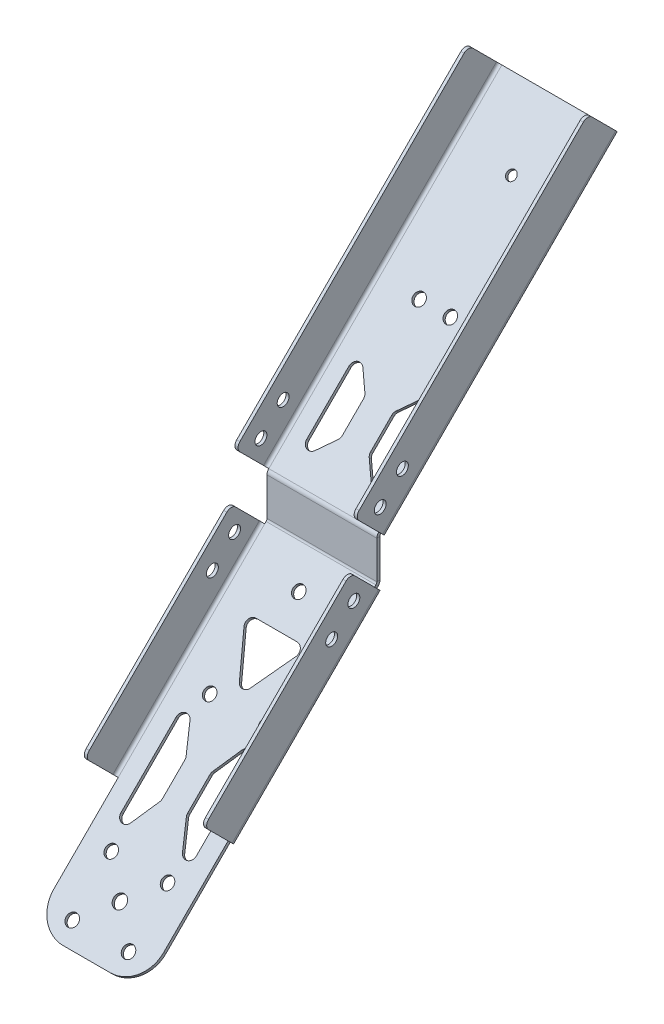
from build123d import *

# Parameters (mm, degrees)
BASE_FLANGE1_DEPTH     = 1
SKETCHED_START         = -32.5
SKETCHED_BEND5_DEPTH   = 65
SKETCHED_BEND5_2_DEPTH = 15
SKETCHED_START_2       = 17.5
SKETCHED_BEND5_3_DEPTH = 15
SKETCHED_BEND5_4_DEPTH = 65
SKETCHED_START_3       = -17.5
SKETCHED_BEND5_5_DEPTH = 35
SKETCHED_BEND6_DEPTH   = 65
SKETCHED_BEND6_2_DEPTH = 15
SKETCHED_BEND6_3_DEPTH = 15
SKETCHED_BEND6_4_DEPTH = 65
SKETCHED_BEND6_5_DEPTH = 35
SKETCHED_START_4       = -71.356310605
SKETCHED_BEND7_DEPTH   = 66
SKETCHED_BEND7_2_DEPTH = 66
SKETCHED_START_5       = 5.890889039
SKETCHED_BEND8_DEPTH   = 105
SKETCHED_BEND8_2_DEPTH = 105
F_6_CLEARANCE_HOLE2_D  = 3.7973
CUT_EXTRUDE1_REACH     = 121.977
SKETCH16_R             = 1.525
CUT_EXTRUDE2_REACH     = 127.221
SKETCH31_R             = 2.025
F_6_CLEARANCE_HOLE4_D  = 3.7973
F_6_CLEARANCE_HOLE5_D  = 3.7973
FILLET1_R              = 10
FILLET2_R              = 2


# Read off the part's stored shape, not the designer's step: Sketched Bend5, Sketched Bend6, Sketched Bend7, Sketched Bend8
# Sheet-metal steps are written as plain solids
with BuildPart() as part:
    # Sketch1 → Base-Flange1 (new body)
    with BuildSketch(Plane.XY):
        Polygon((-32.5, -73.5), (-17.5, -73.5), (-17.5, -112.5), (17.5, -112.5), (17.5, -73.5), (32.5, -73.5), (32.5, -7.5), (17.5, -7.5), (17.5, 7.5), (32.5, 7.5), (32.5, 112.5), (17.5, 112.5), (-17.5, 112.5), (-32.5, 112.5), (-32.5, 7.5), (-17.5, 7.5), (-17.5, -7.5), (-32.5, -7.5), align=None)
    extrude(amount=-BASE_FLANGE1_DEPTH)

    # Sketched Bend5 outline → Sketched Bend5 (cut)
    with BuildSketch(Plane.YZ.offset(SKETCHED_START)):
        with BuildLine():
            Line((7.714213562, -0.585786438), (8.128427124, -1))
            Line((8.128427124, -1), (112.5, -1))
            Line((112.5, -1), (112.5, 0))
            Line((112.5, 0), (6.3, 0))
            ThreePointArc((6.3, 0), (7.065366865, -0.152240935), (7.714213562, -0.585786438))
        make_face()
    extrude(amount=SKETCHED_BEND5_DEPTH, mode=Mode.SUBTRACT)

    # Sketched Bend5 2 outline → Sketched Bend5 2 (cut)
    with BuildSketch(Plane.YZ.offset(SKETCHED_START)):
        with BuildLine():
            Line((7.729701149, -0.601274024), (7.714213562, -0.585786438))
            ThreePointArc((7.714213562, -0.585786438), (7.610403483, -0.48909209), (7.5, -0.4))
            Line((7.5, -0.4), (7.5, -0.830975173))
            Line((7.5, -0.830975173), (7.729701149, -0.601274024))
        make_face()
    extrude(amount=SKETCHED_BEND5_2_DEPTH, mode=Mode.SUBTRACT)

    # Sketched Bend5 3 outline → Sketched Bend5 3 (cut)
    with BuildSketch(Plane.YZ.offset(SKETCHED_START_2)):
        with BuildLine():
            Line((7.729701149, -0.601274024), (7.714213562, -0.585786438))
            ThreePointArc((7.714213562, -0.585786438), (7.610403483, -0.48909209), (7.5, -0.4))
            Line((7.5, -0.4), (7.5, -0.830975173))
            Line((7.5, -0.830975173), (7.729701149, -0.601274024))
        make_face()
    extrude(amount=SKETCHED_BEND5_3_DEPTH, mode=Mode.SUBTRACT)

    # Sketched Bend5 4 outline → Sketched Bend5 4 (add)
    with BuildSketch(Plane.YZ.offset(SKETCHED_START)):
        Polygon((81.975913173, -74.847486049), (8.128427124, -1), (7.5, -1), (7.5, -0.830975173), (7.022594368, -1.308380805), (81.268806392, -75.55459283), align=None)
    extrude(amount=SKETCHED_BEND5_4_DEPTH)

    # Sketched Bend5 5 outline → Sketched Bend5 5 (add)
    with BuildSketch(Plane.YZ.offset(SKETCHED_START_3)):
        with BuildLine():
            Line((7.022594368, -1.308380805), (7.330975173, -1))
            Line((7.330975173, -1), (6.3, -1))
            ThreePointArc((6.3, -1), (6.682683432, -1.076120467), (7.007106781, -1.292893219))
            Line((7.007106781, -1.292893219), (7.022594368, -1.308380805))
        make_face()
    extrude(amount=SKETCHED_BEND5_5_DEPTH)

    # Sketched Bend6 outline → Sketched Bend6 (cut)
    with BuildSketch(Plane.YZ.offset(SKETCHED_START)):
        with BuildLine():
            ThreePointArc((-5.710951377, -1), (-6.476318242, -0.847759065), (-7.12516494, -0.414213562))
            Line((-7.12516494, -0.414213562), (-7.539378502, 0))
            Line((-7.539378502, 0), (-112.5, 0))
            Line((-112.5, 0), (-112.5, -1))
            Line((-112.5, -1), (-5.710951377, -1))
        make_face()
    extrude(amount=SKETCHED_BEND6_DEPTH, mode=Mode.SUBTRACT)

    # Sketched Bend6 2 outline → Sketched Bend6 2 (cut)
    with BuildSketch(Plane.YZ.offset(SKETCHED_START)):
        Polygon((-7.539378502, 0), (-7.5, -0.039378502), (-7.5, 0), align=None)
    extrude(amount=SKETCHED_BEND6_2_DEPTH, mode=Mode.SUBTRACT)

    # Sketched Bend6 3 outline → Sketched Bend6 3 (cut)
    with BuildSketch(Plane.YZ.offset(SKETCHED_START_2)):
        Polygon((-7.539378502, 0), (-7.5, -0.039378502), (-7.5, 0), align=None)
    extrude(amount=SKETCHED_BEND6_3_DEPTH, mode=Mode.SUBTRACT)



with BuildPart() as body_2:
    # Sketched Bend6 4 outline → Sketched Bend6 4 (new body)
    with BuildSketch(Plane.YZ.offset(SKETCHED_START)):
        Polygon((-54.22622036, 46.686841858), (-7.557172802, 0.0177943), (-6.850066021, 0.724901081), (-53.519113579, 47.393948639), align=None)
    extrude(amount=SKETCHED_BEND6_4_DEPTH)


with BuildPart() as part_1:
    add(part.part)

    add(body_2.part)  # Sketched Bend6 5 merges body 2
    # Sketched Bend6 5 outline → Sketched Bend6 5 (add)
    with BuildSketch(Plane.YZ.offset(SKETCHED_START_3)):
        with BuildLine():
            Line((-7.557172802, 0.0177943), (-7.539378502, 0))
            Line((-7.539378502, 0), (-5.710951377, 0))
            ThreePointArc((-5.710951377, 0), (-6.09363481, 0.076120467), (-6.418058159, 0.292893219))
            Line((-6.418058159, 0.292893219), (-6.850066021, 0.724901081))
            Line((-6.850066021, 0.724901081), (-7.557172802, 0.0177943))
        make_face()
        Polygon((-81.803384826, 74.264006324), (-54.22622036, 46.686841858), (-53.519113579, 47.393948639), (-81.096278045, 74.971113105), align=None)
    extrude(amount=SKETCHED_BEND6_5_DEPTH)

    # Sketched Bend7 outline → Sketched Bend7 (cut)
    with BuildSketch(Plane(origin=(0, 0, 0), x_dir=(1, 0, 0), z_dir=(0, 0.707106781186546, -0.707106781186549)).offset(SKETCHED_START_4)):
        with BuildLine():
            ThreePointArc((-19.232050807, 4.331145665), (-18.5, 5.063196472), (-17.5, 5.331145665))
            Line((-17.5, 5.331145665), (-32.5, 5.331145665))
            Line((-32.5, 5.331145665), (-32.5, 4.331145665))
            Line((-32.5, 4.331145665), (-19.232050807, 4.331145665))
        make_face()
        with BuildLine():
            Line((32.5, 5.331145665), (17.5, 5.331145665))
            ThreePointArc((17.5, 5.331145665), (18.5, 5.063196472), (19.232050807, 4.331145665))
            Line((19.232050807, 4.331145665), (32.5, 4.331145665))
            Line((32.5, 4.331145665), (32.5, 5.331145665))
        make_face()
    extrude(amount=SKETCHED_BEND7_DEPTH, mode=Mode.SUBTRACT)

    # Sketched Bend7 2 outline → Sketched Bend7 2 (add)
    with BuildSketch(Plane(origin=(0, 0, 0), x_dir=(1, 0, 0), z_dir=(0, 0.707106781186546, -0.707106781186549)).offset(SKETCHED_START_4)):
        with BuildLine():
            Line((-17.5, 4.331145665), (-19.232050807, 4.331145665))
            ThreePointArc((-19.232050807, 4.331145665), (-19.431851652, 3.848783755), (-19.5, 3.331145665))
            Line((-19.5, 3.331145665), (-19.5, -9.312659845))
            Line((-19.5, -9.312659845), (-18.5, -9.312659845))
            Line((-18.5, -9.312659845), (-18.5, 3.331145665))
            ThreePointArc((-18.5, 3.331145665), (-18.207106781, 4.038252446), (-17.5, 4.331145665))
        make_face()
        with BuildLine():
            ThreePointArc((19.5, 3.331145665), (19.431851652, 3.848783755), (19.232050807, 4.331145665))
            Line((19.232050807, 4.331145665), (17.5, 4.331145665))
            ThreePointArc((17.5, 4.331145665), (18.207106781, 4.038252446), (18.5, 3.331145665))
            Line((18.5, 3.331145665), (18.5, -9.312659845))
            Line((18.5, -9.312659845), (19.5, -9.312659845))
            Line((19.5, -9.312659845), (19.5, 3.331145665))
        make_face()
    extrude(amount=SKETCHED_BEND7_2_DEPTH)

    # Sketched Bend8 outline → Sketched Bend8 (cut)
    with BuildSketch(Plane(origin=(0, 0, 0), x_dir=(1, 0, 0), z_dir=(0, 0.707106781186546, -0.707106781186549)).offset(SKETCHED_START_5)):
        with BuildLine():
            Line((-32.5, -5.040559159), (-19.232050807, -5.040559159))
            ThreePointArc((-19.232050807, -5.040559159), (-18.5, -4.308508352), (-17.5, -4.040559159))
            Line((-17.5, -4.040559159), (-32.5, -4.040559159))
            Line((-32.5, -4.040559159), (-32.5, -5.040559159))
        make_face()
        with BuildLine():
            Line((32.5, -4.040559159), (17.5, -4.040559159))
            ThreePointArc((17.5, -4.040559159), (18.5, -4.308508352), (19.232050807, -5.040559159))
            Line((19.232050807, -5.040559159), (32.5, -5.040559159))
            Line((32.5, -5.040559159), (32.5, -4.040559159))
        make_face()
    extrude(amount=SKETCHED_BEND8_DEPTH, mode=Mode.SUBTRACT)

    # Sketched Bend8 2 outline → Sketched Bend8 2 (add)
    with BuildSketch(Plane(origin=(0, 0, 0), x_dir=(1, 0, 0), z_dir=(0, 0.707106781186546, -0.707106781186549)).offset(SKETCHED_START_5)):
        with BuildLine():
            ThreePointArc((-19.232050807, -5.040559159), (-19.431851652, -5.522921069), (-19.5, -6.040559159))
            Line((-19.5, -6.040559159), (-19.5, -18.684364669))
            Line((-19.5, -18.684364669), (-18.5, -18.684364669))
            Line((-18.5, -18.684364669), (-18.5, -6.040559159))
            ThreePointArc((-18.5, -6.040559159), (-18.207106781, -5.333452378), (-17.5, -5.040559159))
            Line((-17.5, -5.040559159), (-19.232050807, -5.040559159))
        make_face()
        with BuildLine():
            Line((19.232050807, -5.040559159), (17.5, -5.040559159))
            ThreePointArc((17.5, -5.040559159), (18.207106781, -5.333452378), (18.5, -6.040559159))
            Line((18.5, -6.040559159), (18.5, -18.684364669))
            Line((18.5, -18.684364669), (19.5, -18.684364669))
            Line((19.5, -18.684364669), (19.5, -6.040559159))
            ThreePointArc((19.5, -6.040559159), (19.431851652, -5.522921069), (19.232050807, -5.040559159))
        make_face()
    extrude(amount=SKETCHED_BEND8_2_DEPTH)

    # #6 Clearance Hole2 (through all)
    with Locations(Plane(origin=(19.5, 0, 0), x_dir=(0, 0, -1), z_dir=(1, 0, 0))):
        with Locations((-9.311868306, -5.334166607), (-16.382936118, -12.405234419), (-0.914625389, 16.316668374), (6.156442422, 23.387736186)):
            Hole(F_6_CLEARANCE_HOLE2_D / 2)

    # Sketch16 → Cut-Extrude1 (cut, up to next)
    with BuildSketch(Plane(origin=(0, 3.564213562, 3.564213562), x_dir=(1, 0, 0), z_dir=(0, 0.7071067811865487, 0.7071067811865465)), mode=Mode.PRIVATE) as cut_extrude1_sk1:
        with Locations(Location((0, 90.430889039, 0), (0, 0, 270))):
            Circle(SKETCH16_R)
    cut_extrude1_tool1 = extrude(cut_extrude1_sk1.sketch, amount=-CUT_EXTRUDE1_REACH, mode=Mode.PRIVATE) & part_1.part
    # Sketch16 → Cut-Extrude1 (cut, up to next)
    with BuildSketch(Plane(origin=(0, 3.564213562, 3.564213562), x_dir=(1, 0, 0), z_dir=(0, 0.7071067811865487, 0.7071067811865465)), mode=Mode.PRIVATE) as cut_extrude1_sk2:
        with BuildLine():
            Line((-12.5, 34.910953453), (-12.5, 15.870824627))
            ThreePointArc((-12.5, 15.870824627), (-11.185694979, 13.992042469), (-8.970177604, 14.582553136))
            Line((-8.970177604, 14.582553136), (-4.970177604, 19.332553136))
            ThreePointArc((-4.970177604, 19.332553136), (-4.621217842, 19.935129648), (-4.5, 20.620824627))
            Line((-4.5, 20.620824627), (-4.5, 30.160953453))
            ThreePointArc((-4.5, 30.160953453), (-4.621217842, 30.846648432), (-4.970177604, 31.449224944))
            Line((-4.970177604, 31.449224944), (-8.970177604, 36.199224944))
            ThreePointArc((-8.970177604, 36.199224944), (-11.185694979, 36.789735611), (-12.5, 34.910953453))
        make_face()
    cut_extrude1_tool2 = extrude(cut_extrude1_sk2.sketch, amount=-CUT_EXTRUDE1_REACH, mode=Mode.PRIVATE) & part_1.part
    # Sketch16 → Cut-Extrude1 (cut, up to next)
    with BuildSketch(Plane(origin=(0, 3.564213562, 3.564213562), x_dir=(1, 0, 0), z_dir=(0, 0.7071067811865487, 0.7071067811865465)), mode=Mode.PRIVATE) as cut_extrude1_sk3:
        with BuildLine():
            Line((4.5, 20.620824627), (4.5, 30.160953453))
            ThreePointArc((4.5, 30.160953453), (4.621217842, 30.846648432), (4.970177604, 31.449224944))
            Line((4.970177604, 31.449224944), (8.970177604, 36.199224944))
            ThreePointArc((8.970177604, 36.199224944), (11.185694979, 36.789735611), (12.5, 34.910953453))
            Line((12.5, 34.910953453), (12.5, 15.870824627))
            ThreePointArc((12.5, 15.870824627), (11.185694979, 13.992042469), (8.970177604, 14.582553136))
            Line((8.970177604, 14.582553136), (4.970177604, 19.332553136))
            ThreePointArc((4.970177604, 19.332553136), (4.621217842, 19.935129648), (4.5, 20.620824627))
        make_face()
    cut_extrude1_tool3 = extrude(cut_extrude1_sk3.sketch, amount=-CUT_EXTRUDE1_REACH, mode=Mode.PRIVATE) & part_1.part
    add(cut_extrude1_tool1.solids().sort_by_distance((0, 67.508508, -60.380081))[0], mode=Mode.SUBTRACT)
    add(cut_extrude1_tool2.solids().sort_by_distance((-8.925772, 21.518283, -14.389856))[0], mode=Mode.SUBTRACT)
    add(cut_extrude1_tool3.solids().sort_by_distance((8.925772, 21.518283, -14.389856))[0], mode=Mode.SUBTRACT)

    # Sketch31 → Cut-Extrude2 (cut, up to next)
    with BuildSketch(Plane(origin=(0, -3.769689251, -3.769689251), x_dir=(-1, 0, 0), z_dir=(0, -0.7071067811865487, -0.7071067811865465)), mode=Mode.PRIVATE) as cut_extrude2_sk1:
        with Locations(Location((0, -95.356310605, 0), (0, 0, 90))):
            Circle(SKETCH31_R)
    cut_extrude2_tool1 = extrude(cut_extrude2_sk1.sketch, amount=-CUT_EXTRUDE2_REACH, mode=Mode.PRIVATE) & part_1.part
    # Sketch31 → Cut-Extrude2 (cut, up to next)
    with BuildSketch(Plane(origin=(0, -3.769689251, -3.769689251), x_dir=(-1, 0, 0), z_dir=(0, -0.7071067811865487, -0.7071067811865465)), mode=Mode.PRIVATE) as cut_extrude2_sk2:
        with BuildLine():
            Line((1.732050808, -39.065867303), (8.267949192, -27.745359227))
            ThreePointArc((8.267949192, -27.745359227), (8.267949192, -25.745359227), (6.535898385, -24.745359227))
            Line((6.535898385, -24.745359227), (-6.535898385, -24.745359227))
            ThreePointArc((-6.535898385, -24.745359227), (-8.267949192, -25.745359227), (-8.267949192, -27.745359227))
            Line((-8.267949192, -27.745359227), (-1.732050808, -39.065867303))
            ThreePointArc((-1.732050808, -39.065867303), (0, -40.065867303), (1.732050808, -39.065867303))
        make_face()
    cut_extrude2_tool2 = extrude(cut_extrude2_sk2.sketch, amount=-CUT_EXTRUDE2_REACH, mode=Mode.PRIVATE) & part_1.part
    # Sketch31 → Cut-Extrude2 (cut, up to next)
    with BuildSketch(Plane(origin=(0, -3.769689251, -3.769689251), x_dir=(-1, 0, 0), z_dir=(0, -0.7071067811865487, -0.7071067811865465)), mode=Mode.PRIVATE) as cut_extrude2_sk3:
        with BuildLine():
            Line((-12, -53.065867303), (-12, -77.856310605))
            ThreePointArc((-12, -77.856310605), (-10.490758652, -79.795164891), (-8.240844055, -78.807820122))
            Line((-8.240844055, -78.807820122), (-4.240844055, -71.412598471))
            ThreePointArc((-4.240844055, -71.412598471), (-4.061145713, -70.951847606), (-4, -70.461088954))
            Line((-4, -70.461088954), (-4, -60.461088954))
            ThreePointArc((-4, -60.461088954), (-4.061145713, -59.970330301), (-4.240844055, -59.509579437))
            Line((-4.240844055, -59.509579437), (-8.240844055, -52.114357786))
            ThreePointArc((-8.240844055, -52.114357786), (-10.490758652, -51.127013016), (-12, -53.065867303))
        make_face()
    cut_extrude2_tool3 = extrude(cut_extrude2_sk3.sketch, amount=-CUT_EXTRUDE2_REACH, mode=Mode.PRIVATE) & part_1.part
    # Sketch31 → Cut-Extrude2 (cut, up to next)
    with BuildSketch(Plane(origin=(0, -3.769689251, -3.769689251), x_dir=(-1, 0, 0), z_dir=(0, -0.7071067811865487, -0.7071067811865465)), mode=Mode.PRIVATE) as cut_extrude2_sk4:
        with BuildLine():
            Line((4, -70.461088954), (4, -60.461088954))
            ThreePointArc((4, -60.461088954), (4.061145713, -59.970330301), (4.240844055, -59.509579437))
            Line((4.240844055, -59.509579437), (8.240844055, -52.114357786))
            ThreePointArc((8.240844055, -52.114357786), (10.490758652, -51.127013016), (12, -53.065867303))
            Line((12, -53.065867303), (12, -77.856310605))
            ThreePointArc((12, -77.856310605), (10.490758652, -79.795164891), (8.240844055, -78.807820122))
            Line((8.240844055, -78.807820122), (4.240844055, -71.412598471))
            ThreePointArc((4.240844055, -71.412598471), (4.061145713, -70.951847606), (4, -70.461088954))
        make_face()
    cut_extrude2_tool4 = extrude(cut_extrude2_sk4.sketch, amount=-CUT_EXTRUDE2_REACH, mode=Mode.PRIVATE) & part_1.part
    add(cut_extrude2_tool1.solids().sort_by_distance((0, -71.196783, 63.657405))[0], mode=Mode.SUBTRACT)
    add(cut_extrude2_tool2.solids().sort_by_distance((0, -25.349783, 17.810405))[0], mode=Mode.SUBTRACT)
    add(cut_extrude2_tool3.solids().sort_by_distance((8.518356, -50.057669, 42.518291))[0], mode=Mode.SUBTRACT)
    add(cut_extrude2_tool4.solids().sort_by_distance((-8.518356, -50.057669, 42.518291))[0], mode=Mode.SUBTRACT)

    # #6 Clearance Hole4 (through all)
    with Locations(Plane(origin=(0, -3.769689251, -3.769689251), x_dir=(-1, 0, 0), z_dir=(0, -0.7071067811865487, -0.7071067811865465))):
        with Locations((-10.620743853, -44.745359227), (7.179256147, -44.745359227), (0, -14.745359227), (-8.990903672, -104.181464072), (8.825153467, -104.347214277), (8.990903672, -86.531157138), (-8.825153467, -86.365406932)):
            Hole(F_6_CLEARANCE_HOLE4_D / 2)

    # #6 Clearance Hole5 (through all)
    with Locations(Plane(origin=(0, 2.857106781, 2.857106781), x_dir=(-1, 0, 0), z_dir=(0, -0.7071067811865487, -0.7071067811865465))):
        with Locations((4.97, 55.870889039), (-4.97, 55.870889039)):
            Hole(F_6_CLEARANCE_HOLE5_D / 2)

    # Fillet1
    fillet1_edges = [part_1.edges().sort_by_distance(p)[0] for p in [
        (-17.5, -81.449831436, 74.617559715),
        (17.5, -81.449831436, 74.617559715),
    ]]
    fillet(fillet1_edges, radius=FILLET1_R)

    # Fillet2
    fillet2_edges = [part_1.edges().sort_by_distance(p)[0] for p in [
        (-19, -43.871486182, 57.041576037),
        (-19, 2.797561376, 10.372528478),
        (19, 2.797561376, 10.372528478),
        (19, -43.871486182, 57.041576037),
        (-19, 17.377328546, 9.046353373),
        (-19, 91.623540571, -65.199858652),
        (19, 91.623540571, -65.199858652),
        (19, 17.377328546, 9.046353373),
    ]]
    fillet(fillet2_edges, radius=FILLET2_R)


solid = part_1.part
